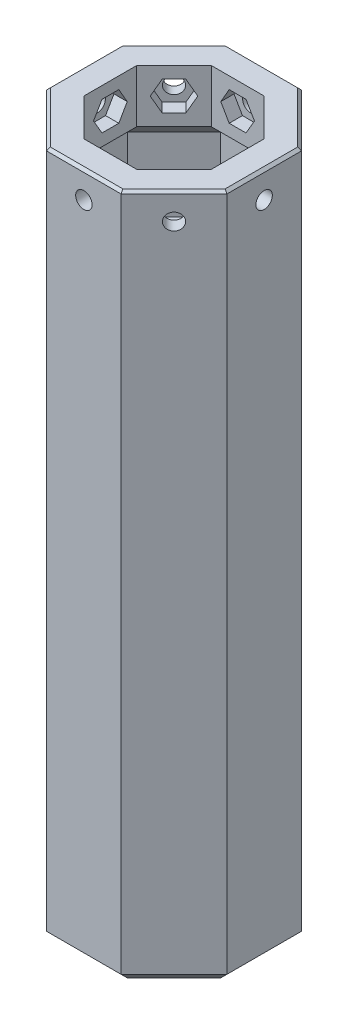
from build123d import *

# Parameters (mm, degrees)
CROQUIS1_R              = 1.55
CROQUIS1_R_2            = 4
SALIENTE_EXTRUIR1_DEPTH = 120
CORTAR_EXTRUIR1_DEPTH   = 117
SALIENTE_EXTRUIR2_DEPTH = 10
CHAFL_N2_SIZE           = 3
CORTAR_EXTRUIR2_REACH   = 138.325
CROQUIS4_R              = 1.55
CHAFL_N3_SIZE           = 0.5
CORTAR_EXTRUIR3_START   = -2.5
CORTAR_EXTRUIR3_DEPTH   = 10
MATRIZC5_COUNT          = 8
CHAFL_N1_SIZE           = 2
CHAFL_N4_SIZE           = 0.5


with BuildPart() as part:
    # Croquis1 → Saliente-Extruir1 (new body)
    with BuildSketch(Plane(origin=(0, 0, 0), x_dir=(1, 0, 0), z_dir=(0, 1, 0))):
        Polygon((17, -7.04163056), (17, 7.04163056), (7.04163056, 17), (-7.04163056, 17), (-17, 7.04163056), (-17, -7.04163056), (-7.04163056, -17), (7.04163056, -17), align=None)
        with Locations(Location((0, 11, 0), (0, 0, 270))):
            Circle(CROQUIS1_R, mode=Mode.SUBTRACT)
        with Locations(Location((0, 0, 0), (0, 0, 270))):
            Circle(CROQUIS1_R_2, mode=Mode.SUBTRACT)
        with Locations(Location((7.778174593, 7.778174593, 0), (0, 0, 270))):
            Circle(CROQUIS1_R, mode=Mode.SUBTRACT)
        with Locations(Location((11, 0, 0), (0, 0, 270))):
            Circle(CROQUIS1_R, mode=Mode.SUBTRACT)
        with Locations(Location((7.778174593, -7.778174593, 0), (0, 0, 270))):
            Circle(CROQUIS1_R, mode=Mode.SUBTRACT)
        with Locations(Location((0, -11, 0), (0, 0, 270))):
            Circle(CROQUIS1_R, mode=Mode.SUBTRACT)
        with Locations(Location((-7.778174593, -7.778174593, 0), (0, 0, 270))):
            Circle(CROQUIS1_R, mode=Mode.SUBTRACT)
        with Locations(Location((-11, 0, 0), (0, 0, 270))):
            Circle(CROQUIS1_R, mode=Mode.SUBTRACT)
        with Locations(Location((-7.778174593, 7.778174593, 0), (0, 0, 270))):
            Circle(CROQUIS1_R, mode=Mode.SUBTRACT)
    extrude(amount=SALIENTE_EXTRUIR1_DEPTH)

    # Croquis2 → Cortar-Extruir1 (cut)
    with BuildSketch(Plane(origin=(0, 120, 0), x_dir=(1, 0, 0), z_dir=(0, 1, 0))):
        Polygon((6.213203436, 15), (-6.213203436, 15), (-15, 6.213203436), (-15, -6.213203436), (-6.213203436, -15), (6.213203436, -15), (15, -6.213203436), (15, 6.213203436), align=None)
    extrude(amount=-CORTAR_EXTRUIR1_DEPTH, mode=Mode.SUBTRACT)

    # Croquis3 → Saliente-Extruir2 (add)
    with BuildSketch(Plane(origin=(0, 120, 0), x_dir=(1, 0, 0), z_dir=(0, 1, 0))):
        Polygon((7.04163056, 17), (-7.04163056, 17), (-17, 7.04163056), (-17, -7.04163056), (-7.04163056, -17), (7.04163056, -17), (17, -7.04163056), (17, 7.04163056), align=None)
        Polygon((12, -4.970562748), (12, 4.970562748), (4.970562748, 12), (-4.970562748, 12), (-12, 4.970562748), (-12, -4.970562748), (-4.970562748, -12), (4.970562748, -12), align=None, mode=Mode.SUBTRACT)
    extrude(amount=SALIENTE_EXTRUIR2_DEPTH)

    # Chaflán2
    chafl_n2_edges = [part.edges().sort_by_distance(p)[0] for p in [
        (10.606601718, 120, -10.606601718),
        (0, 120, -15),
        (-10.606601718, 120, -10.606601718),
        (-15, 120, 0),
        (-10.606601718, 120, 10.606601718),
        (0, 120, 15),
        (10.606601718, 120, 10.606601718),
        (15, 120, 0),
    ]]
    chamfer(chafl_n2_edges, length=CHAFL_N2_SIZE - 0.0001)  # a hair under: the kernel refuses the full size

    # Croquis4 → Cortar-Extruir2 (cut, up to next)
    with BuildSketch(Plane(origin=(-12.02081528, 0, -12.02081528), x_dir=(-0.7071067811865472, 0, 0.7071067811865478), z_dir=(-0.7071067811865478, 0, -0.7071067811865472)), mode=Mode.PRIVATE) as cortar_extruir2_sk1:
        with Locations((0, 125)):
            Circle(CROQUIS4_R)
    cortar_extruir2_tool1 = extrude(cortar_extruir2_sk1.sketch, amount=-CORTAR_EXTRUIR2_REACH, mode=Mode.PRIVATE) & part.part
    cortar_extruir2 = cortar_extruir2_tool1.solids().sort_by_distance((-12.020815, 125, -12.020815))[0]
    add(cortar_extruir2, mode=Mode.SUBTRACT)

    # Chaflán3
    chafl_n3_edges = [part.edges().sort_by_distance(p)[0] for p in [
        (-10.924799769, 125, -13.116830791),
    ]]
    chamfer(chafl_n3_edges, length=CHAFL_N3_SIZE)

    # Croquis5 → Cortar-Extruir3 (cut)
    with BuildSketch(Plane(origin=(-12.02081528, 0, -12.02081528), x_dir=(-0.7071067811865471, 0, 0.7071067811865479), z_dir=(-0.7071067811865479, 0, -0.7071067811865471)).offset(CORTAR_EXTRUIR3_START)):
        Polygon((3.175426481, 125), (1.58771324, 127.75), (-1.58771324, 127.75), (-3.175426481, 125), (-1.58771324, 122.25), (1.58771324, 122.25), align=None)
    cortar_extruir3 = extrude(amount=-CORTAR_EXTRUIR3_DEPTH, mode=Mode.SUBTRACT)

    # MatrizC5: Cortar-Extruir2, Cortar-Extruir3 ×8 about axis
    matrizc5_axis = Axis((0, 0, 0), (0, 1, 0))
    add([cortar_extruir2.rotate(matrizc5_axis, i * 360 / MATRIZC5_COUNT) for i in range(1, MATRIZC5_COUNT)], mode=Mode.SUBTRACT)
    add([cortar_extruir3.rotate(matrizc5_axis, i * 360 / MATRIZC5_COUNT) for i in range(1, MATRIZC5_COUNT)], mode=Mode.SUBTRACT)

    # Chaflán1
    chafl_n1_edges = [part.edges().sort_by_distance(p)[0] for p in [
        (17, 0, 0),
        (12.02081528, 0, 12.02081528),
        (0, 0, 17),
        (-12.02081528, 0, 12.02081528),
        (-17, 0, 0),
        (-12.02081528, 0, -12.02081528),
        (0, 0, -17),
        (12.02081528, 0, -12.02081528),
    ]]
    chamfer(chafl_n1_edges, length=CHAFL_N1_SIZE)

    # Chaflán4
    chafl_n4_edges = [part.edges().sort_by_distance(p)[0] for p in [
        (12.02081528, 130, -12.02081528),
        (0, 130, -17),
        (-12.02081528, 130, -12.02081528),
        (-17, 130, 0),
        (-12.02081528, 130, 12.02081528),
        (0, 130, 17),
        (12.02081528, 130, 12.02081528),
        (17, 130, 0),
    ]]
    chamfer(chafl_n4_edges, length=CHAFL_N4_SIZE)


solid = part.part
